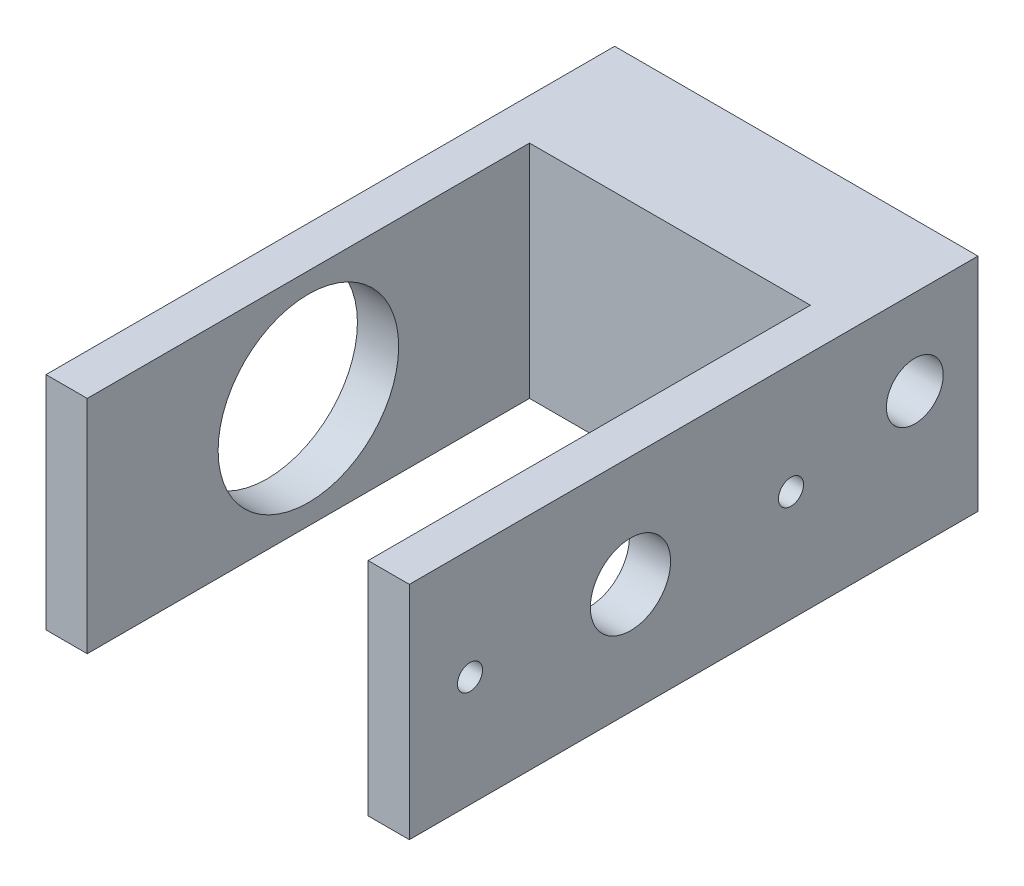
from build123d import *

# Parameters (mm, degrees)
SKETCH1_W           = 90
SKETCH1_H           = 35
SKETCH1_R           = 14.2875
SKETCH1_R_2         = 4.5
BOSS_EXTRUDE1_DEPTH = 6.5278
SKETCH2_W           = 20
SKETCH2_H           = 35
SKETCH2_R           = 4.5
BOSS_EXTRUDE2_DEPTH = 44.45
SKETCH3_R           = 1.984375
SKETCH3_R_2         = 4.5
BOSS_EXTRUDE3_DEPTH = 6.5278


with BuildPart() as part:
    # Sketch1 → Boss-Extrude1 (new body)
    with BuildSketch(Plane(origin=(0, 0, 0), x_dir=(0, 0, -1), z_dir=(1, 0, 0))):
        with Locations((10, 0)):
            Rectangle(SKETCH1_W, SKETCH1_H)
        Circle(SKETCH1_R, mode=Mode.SUBTRACT)
        with Locations((45, 4)):
            Circle(SKETCH1_R_2, mode=Mode.SUBTRACT)
    extrude(amount=BOSS_EXTRUDE1_DEPTH)

    # Sketch2 → Boss-Extrude2 (add)
    with BuildSketch(Plane(origin=(6.5278, 0, 0), x_dir=(0, 0, -1), z_dir=(1, 0, 0))):
        with Locations((45, 0)):
            Rectangle(SKETCH2_W, SKETCH2_H)
        with Locations((45, 4)):
            Circle(SKETCH2_R, mode=Mode.SUBTRACT)
    extrude(amount=BOSS_EXTRUDE2_DEPTH)

    # Sketch3 → Boss-Extrude3 (add)
    with BuildSketch(Plane(origin=(50.9778, 0, 0), x_dir=(0, 0, -1), z_dir=(1, 0, 0))):
        Polygon((-35, 17.5), (-35, 0), (-35, -17.5), (55, -17.5), (55, 17.5), align=None)
        with BuildLine():
            ThreePointArc((-27.384375, 0), (-25.4, 1.984375), (-23.415625, 0))
            ThreePointArc((-23.415625, 0), (-25.4, -1.984375), (-27.384375, 0))
        make_face(mode=Mode.SUBTRACT)
        with BuildLine():
            ThreePointArc((6.35, 0), (0, -6.35), (-6.35, 0))
            ThreePointArc((-6.35, 0), (0, 6.35), (6.35, 0))
        make_face(mode=Mode.SUBTRACT)
        with Locations((25.4, 0)):
            Circle(SKETCH3_R, mode=Mode.SUBTRACT)
        with Locations((45, 4)):
            Circle(SKETCH3_R_2, mode=Mode.SUBTRACT)
    extrude(amount=BOSS_EXTRUDE3_DEPTH)


solid = part.part
